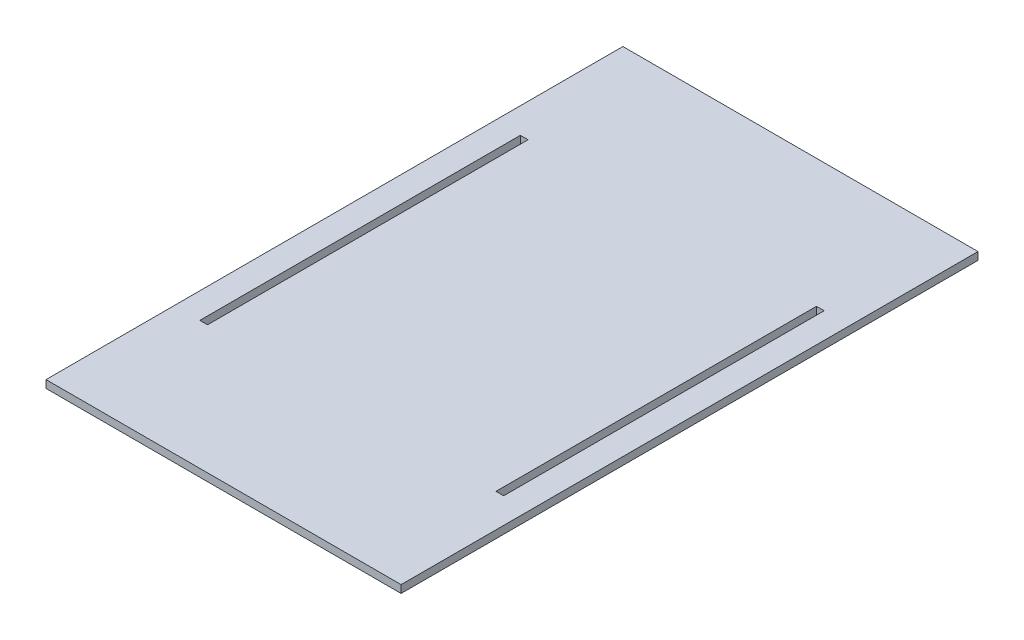
from build123d import *

# Parameters (mm, degrees)
SKETCH1_W           = 277
SKETCH1_H           = 6
BOSS_EXTRUDE1_DEPTH = 450
CUT_EXTRUDE1_REACH  = 520.321
SKETCH2_W           = 6
SKETCH2_H           = 250


with BuildPart() as part:
    # Sketch1 → Boss-Extrude1 (new body)
    with BuildSketch(Plane.XY):
        with Locations((-118.640040599, -11.927850278)):
            Rectangle(SKETCH1_W, SKETCH1_H)
    extrude(amount=BOSS_EXTRUDE1_DEPTH)

    # Sketch2 → Cut-Extrude1 (cut, up to next)
    with BuildSketch(Plane(origin=(0, -8.927850278, 0), x_dir=(1, 0, 0), z_dir=(0, 1, 0)), mode=Mode.PRIVATE) as cut_extrude1_sk1:
        with Locations((-234.140040599, -225)):
            Rectangle(SKETCH2_W, SKETCH2_H)
    cut_extrude1_tool1 = extrude(cut_extrude1_sk1.sketch, amount=-CUT_EXTRUDE1_REACH, mode=Mode.PRIVATE) & part.part
    # Sketch2 → Cut-Extrude1 (cut, up to next)
    with BuildSketch(Plane(origin=(0, -8.927850278, 0), x_dir=(1, 0, 0), z_dir=(0, 1, 0)), mode=Mode.PRIVATE) as cut_extrude1_sk2:
        with Locations((-3.140040599, -225)):
            Rectangle(SKETCH2_W, SKETCH2_H)
    cut_extrude1_tool2 = extrude(cut_extrude1_sk2.sketch, amount=-CUT_EXTRUDE1_REACH, mode=Mode.PRIVATE) & part.part
    add(cut_extrude1_tool1.solids().sort_by_distance((-234.140041, -8.92785, 225))[0], mode=Mode.SUBTRACT)
    add(cut_extrude1_tool2.solids().sort_by_distance((-3.140041, -8.92785, 225))[0], mode=Mode.SUBTRACT)


solid = part.part
